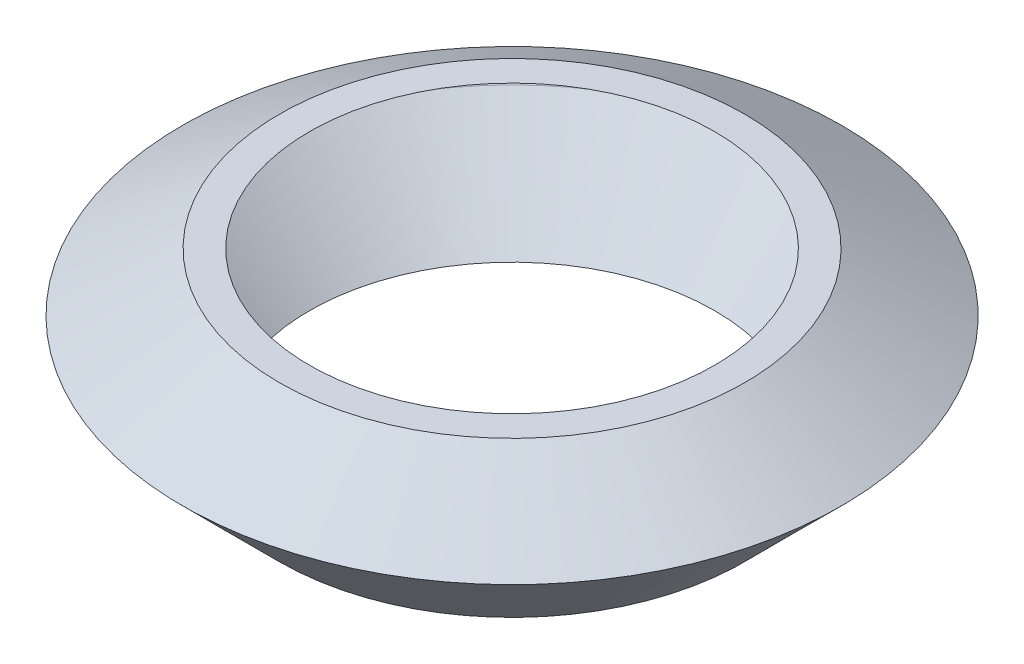
from build123d import *

# Parameters (mm, degrees)
FILLET1_R = 0.4


# Read off the part's stored shape, not the designer's step: Revolve1
with BuildPart() as part:
    # Revolve1 outline → Revolve1 (revolve)
    with BuildSketch(Plane.XY):
        Polygon((15.445079495, 5), (10.445079495, 0), (12, 0), (17, 5), (12, 8), (10.445079495, 8), align=None)
    revolve(axis=Axis((0, 0, 0), (0, 1, 0)))

    # Fillet1
    fillet1_edges = [part.edges().sort_by_distance(p)[0] for p in [
        (-15.445079495, 5, 0),
    ]]
    fillet(fillet1_edges, radius=FILLET1_R)


solid = part.part
